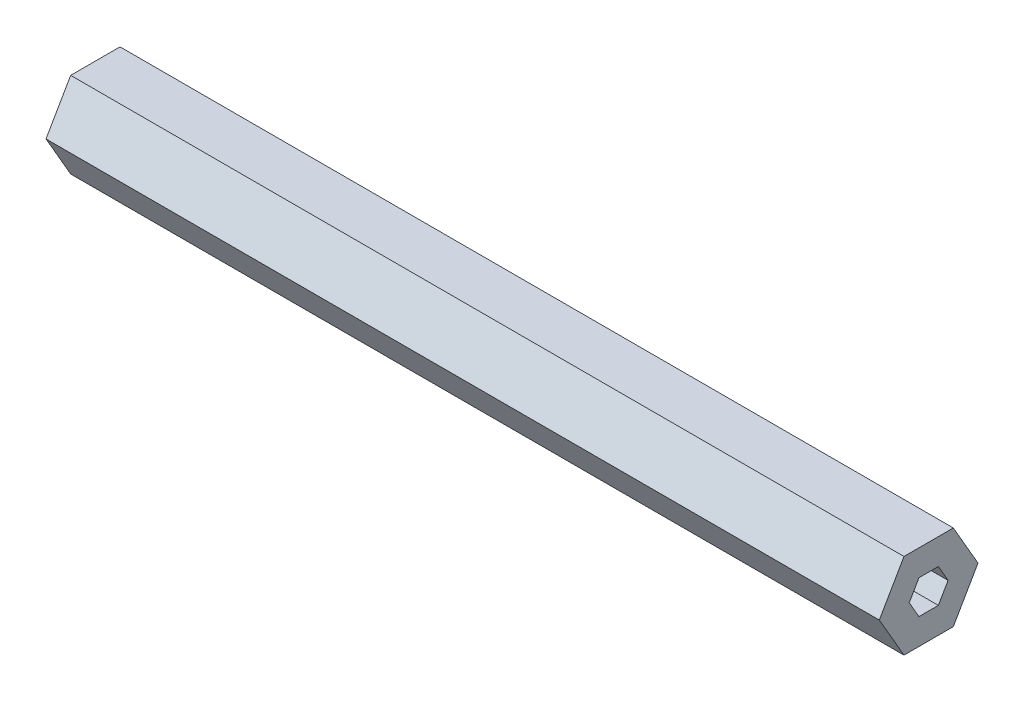
from build123d import *

# Parameters (mm, degrees)
BOSS_EXTRUDE1_DEPTH = 61.9125


with BuildPart() as part:
    # Sketch1 → Boss-Extrude1 (new, symmetric)
    with BuildSketch(Plane(origin=(0, 0, 0), x_dir=(0, 0, -1), z_dir=(1, 0, 0))):
        Polygon((7.332348419, 0), (3.666174209, 6.35), (-3.666174209, 6.35), (-7.332348419, 0), (-3.666174209, -6.35), (3.666174209, -6.35), align=None)
        Polygon((2.886751346, 0), (1.443375673, 2.5), (-1.443375673, 2.5), (-2.886751346, 0), (-1.443375673, -2.5), (1.443375673, -2.5), align=None, mode=Mode.SUBTRACT)
    extrude(amount=BOSS_EXTRUDE1_DEPTH, both=True)


solid = part.part
